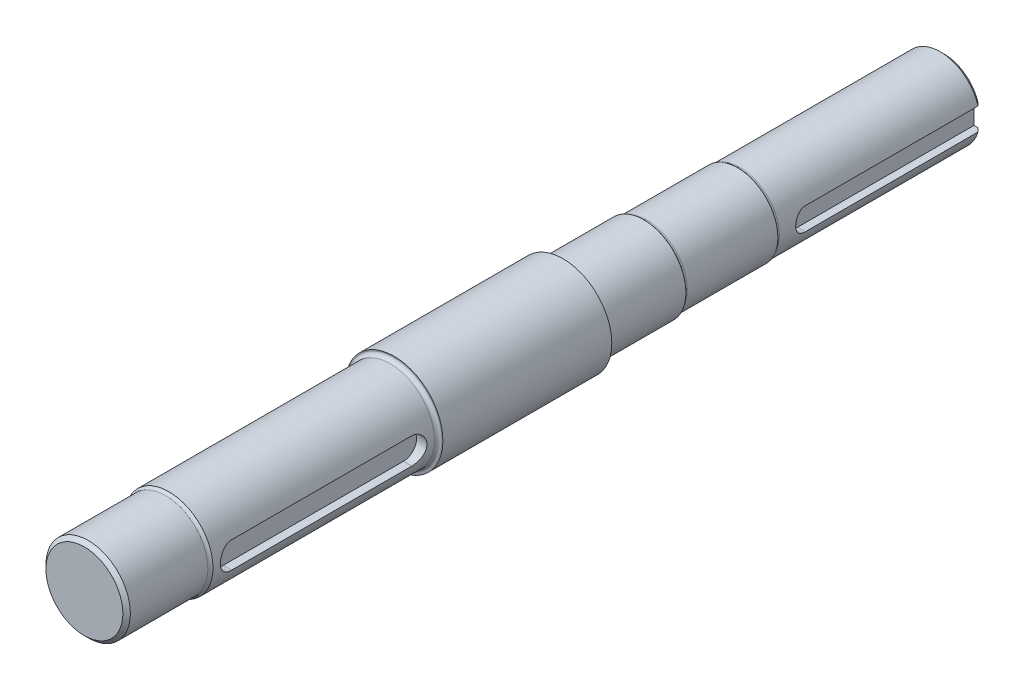
from build123d import *

# Parameters (mm, degrees)
FILLET_1_R          = 2
CHAMFER_1_SIZE      = 2
CUT_EXTRUDE_1_DEPTH = 43
CUT_EXTRUDE_2_DEPTH = 47


with BuildPart() as part:
    # 草图1 → 旋转1 (revolve)
    with BuildSketch(Plane(origin=(0, 0, 0), x_dir=(0, 0, -1), z_dir=(1, 0, 0)), mode=Mode.PRIVATE) as revolve_1_sk:
        with BuildLine():
            Line((-165, 0), (-165, -22.5))
            Line((-165, -22.5), (-120, -22.5))
            Line((-120, -22.5), (-120, -23.5))
            Line((-120, -23.5), (0, -23.5))
            Line((0, -23.5), (0, -26))
            Line((0, -26), (90, -26))
            Line((90, -26), (90, -23))
            ThreePointArc((90, -23), (90.234314575, -22.434314575), (90.8, -22.2))
            Line((90.8, -22.2), (91.7, -22.2))
            Line((91.7, -22.2), (92, -22.5))
            Line((92, -22.5), (133, -22.5))
            Line((133, -22.5), (133, -21.5))
            Line((133, -21.5), (183, -21.5))
            Line((183, -21.5), (183, -21))
            Line((183, -21), (293, -21))
            Line((293, -21), (293, 0))
            Line((293, 0), (-165, 0))
        make_face()
    revolve(revolve_1_sk.sketch.rotate(Axis((0, 0, 440.995541918), (0, 0, -1)), 270), axis=Axis((0, 0, 440.995541918), (0, 0, -1)))

    # 圆角1
    # the kernel refuses this fillet: 2 mm, written as the material it adds along each edge
    with BuildSketch(Plane(origin=(0, 0, 120), x_dir=(1, 0, 0), z_dir=(0, 1, 0))) as fillet_1_piece_1:
        with BuildLine():
            CenterArc((24.5, -1.732050808), FILLET_1_R, 120, 60)
            Line((23.5, 0), (23.48, 0.034641016))
            ThreePointArc((23.48, 0.034641016), (23, 0.04), (22.5, 0.04))
            Line((22.5, 0.04), (22.46, 0))
            Line((22.46, 0), (22.46, -1.732050808))
            Line((22.46, -1.732050808), (22.5, -1.732050808))
        make_face()
    revolve(axis=Axis((0, 0, 120), (0, 0, -1)))
    with BuildSketch(Plane(origin=(0, 0, 0), x_dir=(1, 0, 0), z_dir=(0, 1, 0))) as fillet_1_piece_2:
        with BuildLine():
            CenterArc((23.5 + FILLET_1_R, -FILLET_1_R), FILLET_1_R, 90, 90)
            Line((23.5 + FILLET_1_R, 0), (23.5 + FILLET_1_R, FILLET_1_R * 0.02))
            Line((23.5 + FILLET_1_R, FILLET_1_R * 0.02), (23.5 - FILLET_1_R * 0.02, FILLET_1_R * 0.02))
            Line((23.5 - FILLET_1_R * 0.02, FILLET_1_R * 0.02), (23.5 - FILLET_1_R * 0.02, -FILLET_1_R))
            Line((23.5 - FILLET_1_R * 0.02, -FILLET_1_R), (23.5, -FILLET_1_R))
        make_face()
    revolve(axis=Axis((0, 0, 0), (0, 0, -1)))
    with BuildSketch(Plane(origin=(0, 0, -133), x_dir=(1, 0, 0), z_dir=(0, 1, 0))) as fillet_1_piece_3:
        with BuildLine():
            CenterArc((23.5, 1.732050808), FILLET_1_R, 180, 60)
            Line((21.5, 1.732050808), (21.46, 1.732050808))
            Line((21.46, 1.732050808), (21.46, 0))
            Line((21.46, 0), (21.5, -0.04))
            ThreePointArc((21.5, -0.04), (22, -0.04), (22.48, -0.034641016))
            Line((22.48, -0.034641016), (22.5, 0))
        make_face()
    revolve(axis=Axis((0, 0, -133), (0, 0, -1)))
    with BuildSketch(Plane(origin=(0, 0, -183), x_dir=(1, 0, 0), z_dir=(0, 1, 0))) as fillet_1_piece_4:
        with BuildLine():
            CenterArc((23, 1.322875656), FILLET_1_R, 180, 41.409622109)
            Line((21, 1.322875656), (20.96, 1.322875656))
            Line((20.96, 1.322875656), (20.96, 0))
            Line((20.96, 0), (21, -0.04))
            ThreePointArc((21, -0.04), (21.25, -0.04), (21.47, -0.026457513))
            Line((21.47, -0.026457513), (21.5, 0))
        make_face()
    revolve(axis=Axis((0, 0, -183), (0, 0, -1)))

    # 倒角1
    chamfer_1_edges = [part.edges().sort_by_distance(p)[0] for p in [
        (-22.5, 0, 165),
        (-21, 0, -293),
    ]]
    chamfer(chamfer_1_edges, length=CHAMFER_1_SIZE)

    # 草图3 → 切除-拉伸1 (cut)
    with BuildSketch(Plane(origin=(18, 0, 0), x_dir=(0, 0, -1), z_dir=(1, 0, 0))):
        with BuildLine():
            Line((-109, 7), (-13, 7))
            ThreePointArc((-13, 7), (-6, 0), (-13, -7))
            Line((-13, -7), (-109, -7))
            ThreePointArc((-109, -7), (-116, 0), (-109, 7))
        make_face()
    extrude(amount=CUT_EXTRUDE_1_DEPTH, mode=Mode.SUBTRACT)

    # 草图4 → 切除-拉伸2 (cut)
    with BuildSketch(Plane(origin=(16, 0, 0), x_dir=(0, 0, -1), z_dir=(1, 0, 0))):
        with BuildLine():
            Line((199, 6), (293, 6))
            Line((293, 6), (293, -6))
            Line((293, -6), (199, -6))
            ThreePointArc((199, -6), (193, 0), (199, 6))
        make_face()
    extrude(amount=CUT_EXTRUDE_2_DEPTH, mode=Mode.SUBTRACT)


solid = part.part
